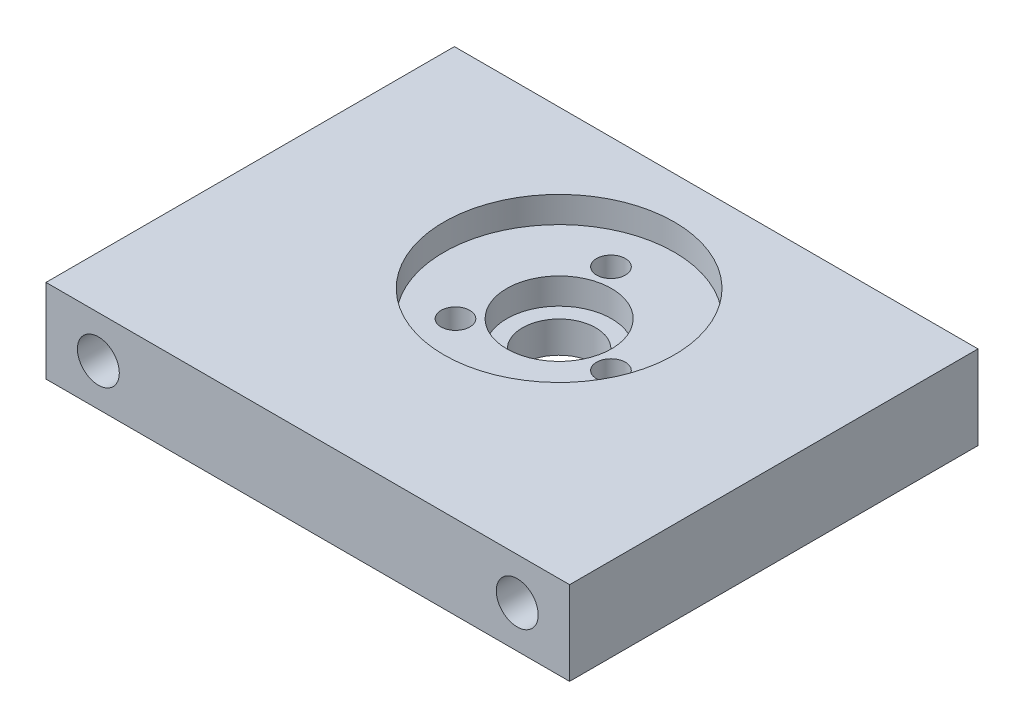
from build123d import *

# Parameters (mm, degrees)
ESQUISSE1_W             = 50
ESQUISSE1_H             = 39
BOSS_EXTRU_1_DEPTH      = 8
ESQUISSE2_R             = 5
ENL_V_MAT_EXTRU_1_DEPTH = 5
ESQUISSE3_R             = 1.375
ESQUISSE3_R_2           = 3.5
ENL_V_MAT_EXTRU_2_DEPTH = 15
ESQUISSE4_R             = 11
ENL_V_MAT_EXTRU_3_DEPTH = 2.5
ESQUISSE5_R             = 2.25
ENL_V_MAT_EXTRU_4_DEPTH = 2.5
ESQUISSE6_R             = 2
ENL_V_MAT_EXTRU_5_DEPTH = 10


with BuildPart() as part:
    # Esquisse1 → Boss.-Extru.1 (new body)
    with BuildSketch(Plane(origin=(0, 0, 0), x_dir=(1, 0, 0), z_dir=(0, 1, 0))):
        Rectangle(ESQUISSE1_W, ESQUISSE1_H)
    extrude(amount=BOSS_EXTRU_1_DEPTH)

    # Esquisse2 → Enlèv. mat.-Extru.1 (cut)
    with BuildSketch(Plane(origin=(0, 8, 0), x_dir=(1, 0, 0), z_dir=(0, 1, 0))):
        with Locations((0, 4.5)):
            Circle(ESQUISSE2_R)
    extrude(amount=-ENL_V_MAT_EXTRU_1_DEPTH, mode=Mode.SUBTRACT)

    # Esquisse3 → Enlèv. mat.-Extru.2 (cut)
    with BuildSketch(Plane(origin=(0, 8, 0), x_dir=(1, 0, 0), z_dir=(0, 1, 0))):
        with Locations((-1.811733316, 11.261480784)):
            Circle(ESQUISSE3_R)
        with Locations((6.761480784, 2.688266684)):
            Circle(ESQUISSE3_R)
        with Locations((-4.949747468, -0.449747468)):
            Circle(ESQUISSE3_R)
        with Locations((0, 4.5)):
            Circle(ESQUISSE3_R_2)
    extrude(amount=-ENL_V_MAT_EXTRU_2_DEPTH, mode=Mode.SUBTRACT)

    # Esquisse4 → Enlèv. mat.-Extru.3 (cut)
    with BuildSketch(Plane(origin=(0, 8, 0), x_dir=(1, 0, 0), z_dir=(0, 1, 0))):
        with Locations((0, 4.5)):
            Circle(ESQUISSE4_R)
    extrude(amount=-ENL_V_MAT_EXTRU_3_DEPTH, mode=Mode.SUBTRACT)

    # Esquisse5 → Enlèv. mat.-Extru.4 (cut)
    with BuildSketch(Plane.XZ):
        with Locations((-4.949747468, 0.449747468)):
            Circle(ESQUISSE5_R)
        with Locations((6.761480784, -2.688266684)):
            Circle(ESQUISSE5_R)
        with Locations((-1.811733316, -11.261480784)):
            Circle(ESQUISSE5_R)
    extrude(amount=-ENL_V_MAT_EXTRU_4_DEPTH, mode=Mode.SUBTRACT)

    # Esquisse6 → Enlèv. mat.-Extru.5 (cut)
    with BuildSketch(Plane.XY.offset(19.5)):
        with Locations((-20, 4)):
            Circle(ESQUISSE6_R)
        with Locations((20, 4)):
            Circle(ESQUISSE6_R)
    extrude(amount=-ENL_V_MAT_EXTRU_5_DEPTH, mode=Mode.SUBTRACT)


solid = part.part
